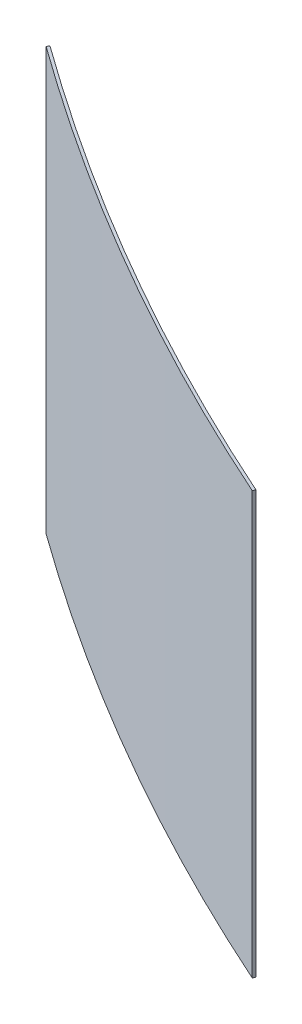
from build123d import *

# Parameters (mm, degrees)
SM_BASE_FLANGE_1_DEPTH = 75


# Sheet-metal steps are written as plain solids
with BuildPart() as part:
    # Sketch 1 → 基体-法兰1 (new, symmetric)
    with BuildSketch(Plane(origin=(0, 0, 0), x_dir=(1, 0, 0), z_dir=(0, 1, 0))):
        with BuildLine():
            ThreePointArc((-576.80919323, -799.062828947), (-492.75, -853.46803543), (-403.604112473, -899.062828947))
            Line((-403.604112473, -899.062828947), (-404.013654952, -899.975119996))
            ThreePointArc((-404.013654952, -899.975119996), (-493.25, -854.334060833), (-577.394489215, -799.873648662))
            Line((-577.394489215, -799.873648662), (-576.80919323, -799.062828947))
        make_face()
    extrude(amount=SM_BASE_FLANGE_1_DEPTH, both=True)


solid = part.part
